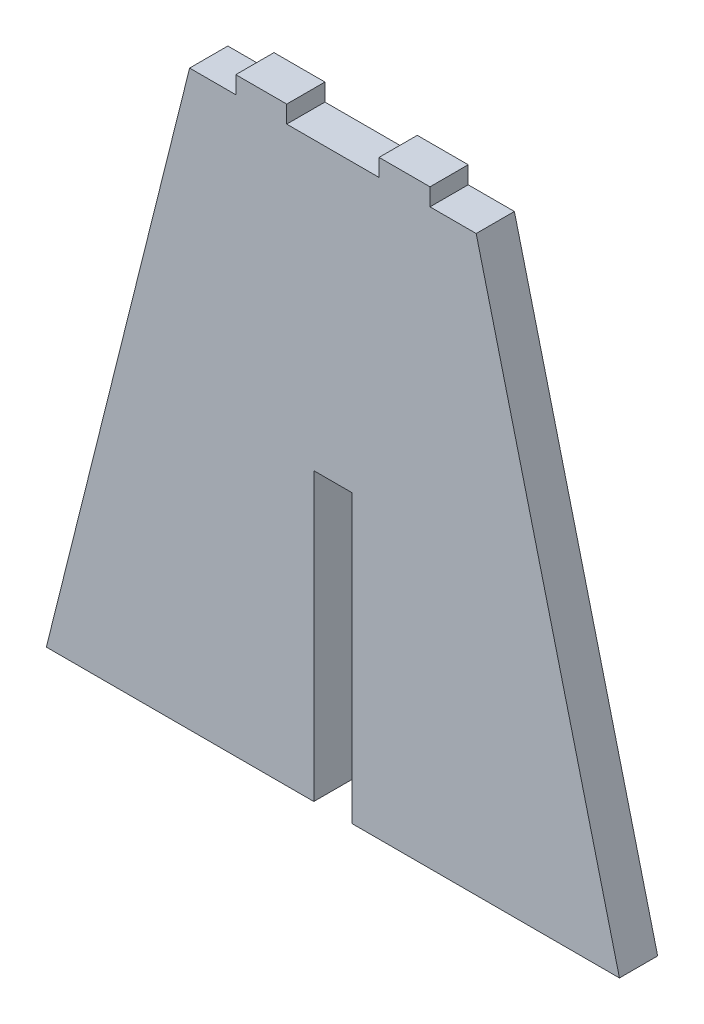
from build123d import *

# Parameters (mm, degrees)
BOSS_EXTRUDE4_DEPTH = 6


with BuildPart() as part:
    # Sketch2 → Boss-Extrude4 (new body)
    with BuildSketch(Plane.XY):
        Polygon((45, 9.865384615), (3, 9.865384615), (3, 54.865384615), (-3, 54.865384615), (-3, 9.865384615), (-45, 9.865384615), (-22.5, 99.865384615), (-15.25, 99.865384615), (-15.25, 102.593822904), (-7.25, 102.593822904), (-7.25, 99.865384615), (7.25, 99.865384615), (7.25, 102.593822904), (15.25, 102.593822904), (15.25, 99.865384615), (22.5, 99.865384615), align=None)
    extrude(amount=BOSS_EXTRUDE4_DEPTH)


solid = part.part
